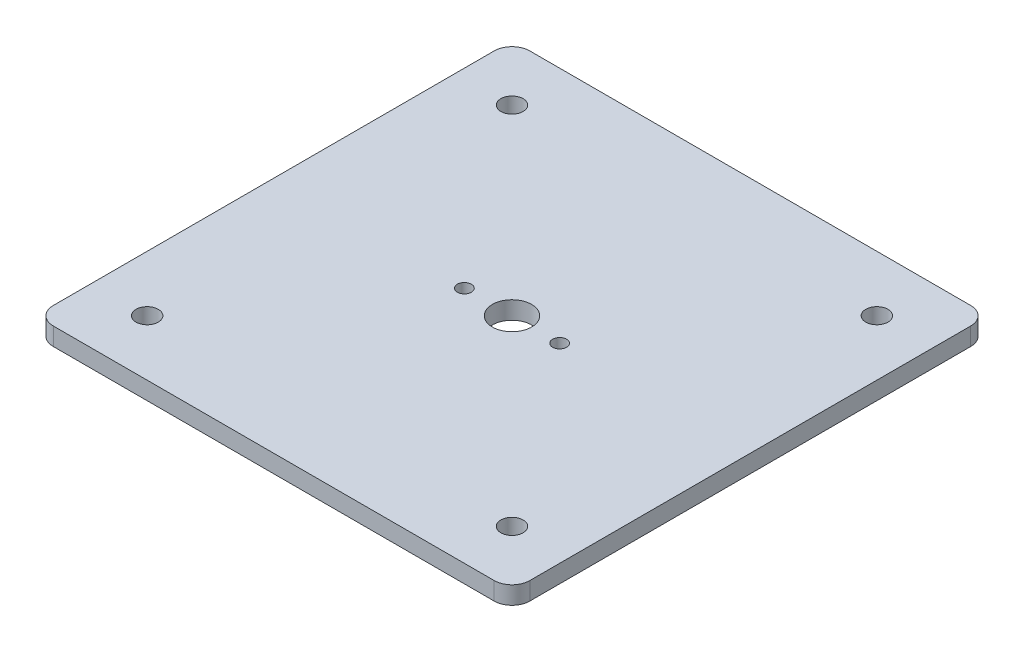
from build123d import *

# Parameters (mm, degrees)
SKETCH1_W             = 85
SKETCH1_H             = 85
BOSS_EXTRUDE1_DEPTH   = 3.175
SKETCH2_R             = 1.985
CUT_EXTRUDE1_DEPTH    = 121.250075364
LPATTERN1_COUNT       = 2
LPATTERN1_PITCH       = 65.09
LPATTERN1_COUNT_DIR2  = 2
LPATTERN1_PITCH_DIR2  = 65.09
FILLET1_R             = 3.175
SKETCH3_R             = 3.5
CUT_EXTRUDE2_DEPTH    = 121.250075364
M3X0_5_TAPPED_HOLE1_D = 2.5


with BuildPart() as part:
    # Sketch1 → Boss-Extrude1 (new body)
    with BuildSketch(Plane(origin=(0, 0, 0), x_dir=(1, 0, 0), z_dir=(0, 1, 0))):
        with Locations((42.5, 42.5)):
            Rectangle(SKETCH1_W, SKETCH1_H)
    extrude(amount=BOSS_EXTRUDE1_DEPTH)

    # Sketch2 → Cut-Extrude1 (cut, through all)
    with BuildSketch(Plane(origin=(0, 3.175, 0), x_dir=(1, 0, 0), z_dir=(0, 1, 0))):
        with Locations((9.955, 75.045)):
            Circle(SKETCH2_R)
    cut_extrude1 = extrude(amount=-CUT_EXTRUDE1_DEPTH, mode=Mode.SUBTRACT)

    # LPattern1: Cut-Extrude1 2 × 2
    with Locations(*[(j * LPATTERN1_PITCH_DIR2, 0, i * LPATTERN1_PITCH) for i in range(LPATTERN1_COUNT) for j in range(LPATTERN1_COUNT_DIR2) if (i, j) != (0, 0)]):
        add(cut_extrude1, mode=Mode.SUBTRACT)

    # Fillet1
    fillet1_edges = [part.edges().sort_by_distance(p)[0] for p in [
        (0, 1.5875, 0),
        (85, 1.5875, 0),
        (85, 1.5875, -85),
        (0, 1.5875, -85),
    ]]
    fillet(fillet1_edges, radius=FILLET1_R)

    # Sketch3 → Cut-Extrude2 (cut, through all)
    with BuildSketch(Plane(origin=(0, 3.175, 0), x_dir=(1, 0, 0), z_dir=(0, 1, 0))):
        with Locations((42.5, 42.5)):
            Circle(SKETCH3_R)
    extrude(amount=-CUT_EXTRUDE2_DEPTH, mode=Mode.SUBTRACT)

    # M3x0.5 Tapped Hole1 (through all)
    with Locations(Plane(origin=(0, 3.175, 0), x_dir=(1, 0, 0), z_dir=(0, 1, 0))):
        with Locations((34, 42.5), (51, 42.5)):
            Hole(M3X0_5_TAPPED_HOLE1_D / 2)


solid = part.part
